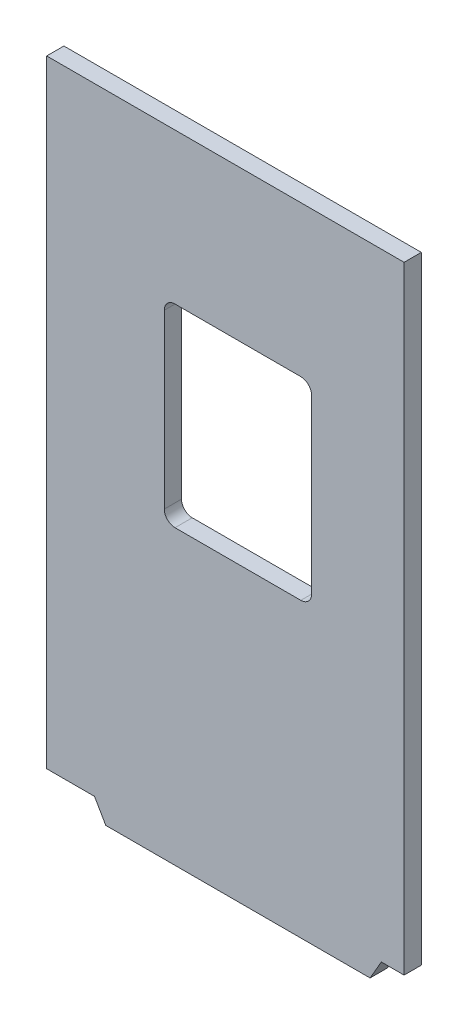
from build123d import *
from OCP.BRepAlgoAPI import BRepAlgoAPI_Cut
from OCP.TopTools import TopTools_ListOfShape

# Parameters (mm, degrees)
SKETCH1_W           = 20
SKETCH1_H           = 30
BOSS_EXTRUDE1_DEPTH = 1.6
SKETCH2_W           = 1.6
SKETCH2_H           = 30
BOSS_EXTRUDE2_DEPTH = 13.22962
SKETCH3_W           = 33.229619685
SKETCH3_H           = 1.6
BOSS_EXTRUDE3_DEPTH = 29.21
CUT_EXTRUDE1_DEPTH  = 1.6
CUT_EXTRUDE2_DEPTH  = 29.21


with BuildPart() as part:
    # Sketch1 → Boss-Extrude1 (new body)
    with BuildSketch(Plane.XY):
        Rectangle(SKETCH1_W, SKETCH1_H)
    extrude(amount=BOSS_EXTRUDE1_DEPTH)

    # Sketch2 → Boss-Extrude2 (add)
    with BuildSketch(Plane.ZY.offset(10)):
        with Locations((0.8, 0)):
            Rectangle(SKETCH2_W, SKETCH2_H)
    extrude(amount=BOSS_EXTRUDE2_DEPTH)

    # Sketch3 → Boss-Extrude3 (add)
    with BuildSketch(Plane(origin=(0, 15, 0), x_dir=(1, 0, 0), z_dir=(0, 1, 0))):
        with Locations((-6.614809843, -0.8)):
            Rectangle(SKETCH3_W, SKETCH3_H)
    extrude(amount=BOSS_EXTRUDE3_DEPTH)

    # Sketch4 → Cut-Extrude1 (cut)
    with BuildSketch(Plane(origin=(0, 0, 0), x_dir=(-1, 0, 0), z_dir=(0, 0, -1))):
        with BuildLine():
            Line((-1.398817815, 13.19), (-1.398817815, 29.2))
            ThreePointArc((-1.398817815, 29.2), (-1.105924597, 29.907106781), (-0.398817815, 30.2))
            Line((-0.398817815, 30.2), (11.298057185, 30.2))
            ThreePointArc((11.298057185, 30.2), (12.005163966, 29.907106781), (12.298057185, 29.2))
            Line((12.298057185, 29.2), (12.298057185, 13.19))
            ThreePointArc((12.298057185, 13.19), (12.005163966, 12.482893219), (11.298057185, 12.19))
            Line((11.298057185, 12.19), (-0.398817815, 12.19))
            ThreePointArc((-0.398817815, 12.19), (-1.105924597, 12.482893219), (-1.398817815, 13.19))
        make_face()
    extrude(amount=-CUT_EXTRUDE1_DEPTH, mode=Mode.SUBTRACT)


with BuildPart() as cut_extrude2_tool:
    # Sketch5 → Cut-Extrude2 (new body)
    with BuildSketch(Plane(origin=(0, 0, 0), x_dir=(-1, 0, 0), z_dir=(0, 0, -1))):
        Polygon((-7.883969717, -13.186759938), (-6.837095086, -15), (-10, -15), (-10, -13.186759938), align=None)
        Polygon((17.736334458, -15), (18.783209096, -13.186759938), (19.63963747, -13.186759938), (23.229619685, -13.186759938), (23.229619685, -15), align=None)
    extrude(amount=-CUT_EXTRUDE2_DEPTH)


with BuildPart() as part_1:
    add(part.part)

    # Cut-Extrude2: cut by cut_extrude2_tool, with a tolerance
    cut_extrude2_stock = TopTools_ListOfShape()
    cut_extrude2_stock.Append(part_1.part.wrapped)
    cut_extrude2_tools = TopTools_ListOfShape()
    cut_extrude2_tools.Append(cut_extrude2_tool.part.wrapped)
    cut_extrude2_cut = BRepAlgoAPI_Cut()
    cut_extrude2_cut.SetArguments(cut_extrude2_stock)
    cut_extrude2_cut.SetTools(cut_extrude2_tools)
    cut_extrude2_cut.SetFuzzyValue(0.00001)
    cut_extrude2_cut.Build()
    add(Compound.cast(cut_extrude2_cut.Shape()).solids(), mode=Mode.REPLACE)


solid = part_1.part
